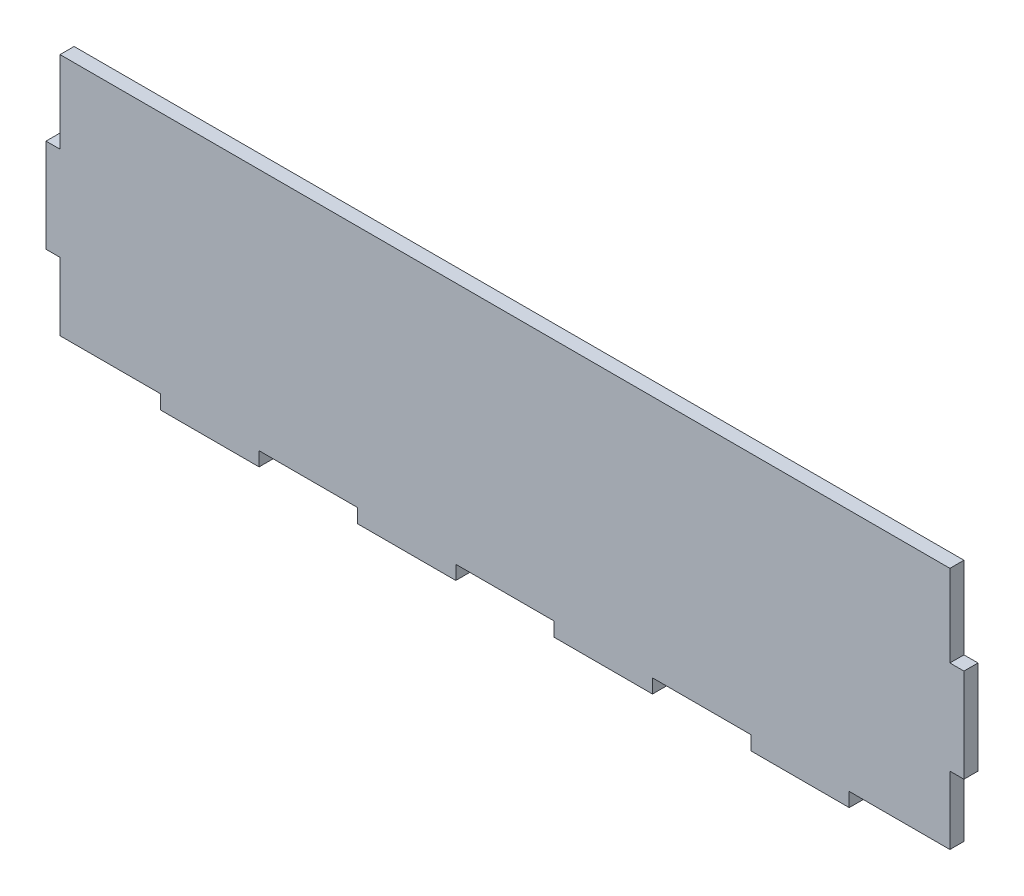
from build123d import *

# Parameters (mm, degrees)
BOSS_EXTRUDE1_DEPTH = 3


with BuildPart() as part:
    # Sketch1 → Boss-Extrude1 (new body)
    with BuildSketch(Plane.XY):
        Polygon((-10.5, -24.5), (0, -24.5), (10.5, -24.5), (10.5, -27.5), (31.5, -27.5), (31.5, -24.5), (52.5, -24.5), (52.5, -27.5), (73.5, -27.5), (73.5, -24.5), (95, -24.5), (95, -10), (98, -10), (98, 10), (95, 10), (95, 27.5), (-95, 27.5), (-95, 10), (-98, 10), (-98, -10), (-95, -10), (-95, -24.5), (-73.5, -24.5), (-73.5, -27.5), (-52.5, -27.5), (-52.5, -24.5), (-31.5, -24.5), (-31.5, -27.5), (-10.5, -27.5), align=None)
    extrude(amount=BOSS_EXTRUDE1_DEPTH)


solid = part.part
